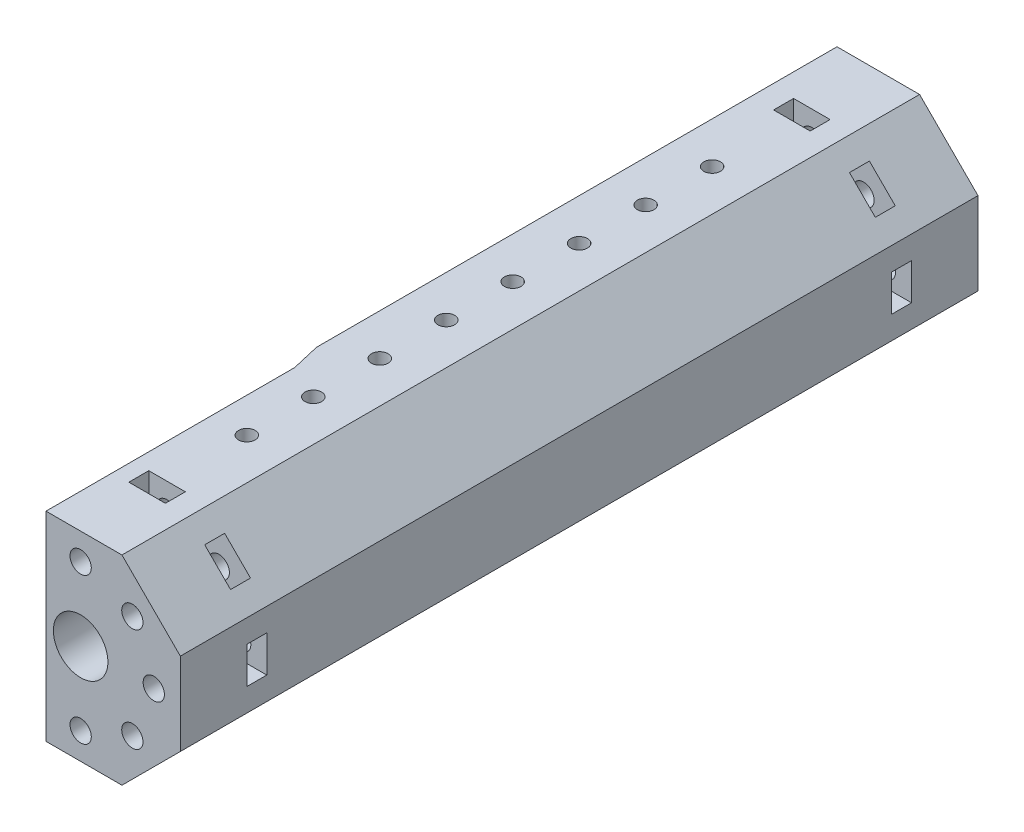
from build123d import *

# Parameters (mm, degrees)
SALIENTE_EXTRUIR1_DEPTH = 60
CROQUIS2_R              = 1.6
CORTAR_EXTRUIR1_DEPTH   = 20
CORTAR_EXTRUIR2_START   = -10
CORTAR_EXTRUIR2_DEPTH   = 3
CROQUIS4_R              = 4.1
CORTAR_EXTRUIR3_DEPTH   = 122.86057607
CORTAR_EXTRUIR4_DEPTH   = 125.599357944
CORTAR_EXTRUIR5_START   = -20
CROQUIS6_R              = 1.6
CORTAR_EXTRUIR5_DEPTH   = 20
CORTAR_EXTRUIR6_START   = -10
CORTAR_EXTRUIR6_DEPTH   = 3
CROQUIS8_R              = 1.25
CORTAR_EXTRUIR8_DEPTH   = 125.599357944
MATRIZL1_COUNT          = 8
MATRIZL1_PITCH          = 10
CHAFL_N1_SIZE           = 1


with BuildPart() as part:
    # Croquis1 → Saliente-Extruir1 (new body)
    with BuildSketch(Plane.XY):
        Polygon((15, -6.213203436), (15, 6.213203436), (6.213203436, 15), (-6.213203436, 15), (-15, 6.213203436), (-15, -6.213203436), (-6.213203436, -15), (6.213203436, -15), align=None)
    saliente_extruir1 = extrude(amount=SALIENTE_EXTRUIR1_DEPTH)

    # Croquis2 → Cortar-Extruir1 (cut)
    with BuildSketch(Plane(origin=(0, 0, 0), x_dir=(-1, 0, 0), z_dir=(0, 0, -1))):
        with Locations((0, 11)):
            Circle(CROQUIS2_R)
        with Locations((7.778174593, 7.778174593)):
            Circle(CROQUIS2_R)
        with Locations((11, 0)):
            Circle(CROQUIS2_R)
        with Locations((7.778174593, -7.778174593)):
            Circle(CROQUIS2_R)
        with Locations((0, -11)):
            Circle(CROQUIS2_R)
        with Locations((-7.778174593, -7.778174593)):
            Circle(CROQUIS2_R)
        with Locations((-11, 0)):
            Circle(CROQUIS2_R)
        with Locations((-7.778174593, 7.778174593)):
            Circle(CROQUIS2_R)
    extrude(amount=-CORTAR_EXTRUIR1_DEPTH, mode=Mode.SUBTRACT)

    # Croquis3 → Cortar-Extruir2 (cut)
    with BuildSketch(Plane(origin=(0, 0, 0), x_dir=(-1, 0, 0), z_dir=(0, 0, -1)).offset(CORTAR_EXTRUIR2_START)):
        Polygon((-2.75, 12.58771324), (-2.75, 18.463203436), (2.75, 23.963203436), (2.75, 12.58771324), (2.75, 9.41228676), (0, 7.824573519), (-2.75, 9.41228676), align=None)
        Polygon((6.956313744, 10.84540104), (11.110912703, 15), (18.889087297, 15), (10.84540104, 6.956313744), (8.600035443, 4.710948146), (5.532808996, 5.532808996), (4.710948146, 8.600035443), align=None)
        Polygon((12.58771324, 2.75), (18.463203436, 2.75), (23.963203436, -2.75), (12.58771324, -2.75), (9.41228676, -2.75), (7.824573519, 0), (9.41228676, 2.75), align=None)
        Polygon((10.84540104, -6.956313744), (15, -11.110912703), (15, -18.889087297), (6.956313744, -10.84540104), (4.710948146, -8.600035443), (5.532808996, -5.532808996), (8.600035443, -4.710948146), align=None)
        Polygon((2.75, -12.58771324), (2.75, -18.463203436), (-2.75, -23.963203436), (-2.75, -12.58771324), (-2.75, -9.41228676), (0, -7.824573519), (2.75, -9.41228676), align=None)
        Polygon((-6.956313744, -10.84540104), (-11.110912703, -15), (-18.889087297, -15), (-10.84540104, -6.956313744), (-8.600035443, -4.710948146), (-5.532808995, -5.532808996), (-4.710948146, -8.600035443), align=None)
        Polygon((-12.58771324, -2.75), (-18.463203436, -2.75), (-23.963203436, 2.75), (-12.58771324, 2.75), (-9.41228676, 2.75), (-7.824573519, 0), (-9.41228676, -2.75), align=None)
        Polygon((-10.84540104, 6.956313744), (-15, 11.110912703), (-15, 18.889087297), (-6.956313744, 10.84540104), (-4.710948146, 8.600035443), (-5.532808996, 5.532808996), (-8.600035443, 4.710948146), align=None)
    extrude(amount=-CORTAR_EXTRUIR2_DEPTH, mode=Mode.SUBTRACT)

    # Simetría1: Saliente-Extruir1 across plane
    add(saliente_extruir1.mirror(Plane.XY.offset(60)))

    # Croquis4 → Cortar-Extruir3 (cut, through all)
    with BuildSketch(Plane(origin=(0, 0, 0), x_dir=(-1, 0, 0), z_dir=(0, 0, -1))):
        Circle(CROQUIS4_R)
    extrude(amount=-CORTAR_EXTRUIR3_DEPTH, mode=Mode.SUBTRACT)

    # Croquis5 → Cortar-Extruir4 (cut, through all)
    with BuildSketch(Plane.XZ.offset(15)):
        Polygon((-6.213203436, 120), (-6.213203436, 78.298736304), (-15, 40.569524353), (-15, 120), align=None)
    extrude(amount=-CORTAR_EXTRUIR4_DEPTH, mode=Mode.SUBTRACT)

    # Croquis6 → Cortar-Extruir5 (cut)
    with BuildSketch(Plane.XY.offset(120).offset(CORTAR_EXTRUIR5_START)):
        with Locations((0, 11)):
            Circle(CROQUIS6_R)
        with Locations((7.778174593, 7.778174593)):
            Circle(CROQUIS6_R)
        with Locations((11, 0)):
            Circle(CROQUIS6_R)
        with Locations((7.778174593, -7.778174593)):
            Circle(CROQUIS6_R)
        with Locations((0, -11)):
            Circle(CROQUIS6_R)
    extrude(amount=CORTAR_EXTRUIR5_DEPTH, mode=Mode.SUBTRACT)

    # Croquis7 → Cortar-Extruir6 (cut)
    with BuildSketch(Plane.XY.offset(120).offset(CORTAR_EXTRUIR6_START)):
        Polygon((-2.75, 12.58771324), (-2.75, 18.463203436), (2.75, 23.963203436), (2.75, 12.58771324), (2.75, 9.41228676), (0, 7.824573519), (-2.75, 9.41228676), align=None)
        Polygon((6.956313744, 10.84540104), (11.110912703, 15), (18.889087297, 15), (10.84540104, 6.956313744), (8.600035443, 4.710948146), (5.532808996, 5.532808996), (4.710948146, 8.600035443), align=None)
        Polygon((12.58771324, 2.75), (18.463203436, 2.75), (23.963203436, -2.75), (12.58771324, -2.75), (9.41228676, -2.75), (7.824573519, 0), (9.41228676, 2.75), align=None)
        Polygon((10.84540104, -6.956313744), (15, -11.110912703), (15, -18.889087297), (6.956313744, -10.84540104), (4.710948146, -8.600035443), (5.532808996, -5.532808996), (8.600035443, -4.710948146), align=None)
        Polygon((2.75, -12.58771324), (2.75, -18.463203436), (-2.75, -23.963203436), (-2.75, -12.58771324), (-2.75, -9.41228676), (0, -7.824573519), (2.75, -9.41228676), align=None)
    extrude(amount=-CORTAR_EXTRUIR6_DEPTH, mode=Mode.SUBTRACT)

    # Croquis8 → Cortar-Extruir8 (cut, through all)
    with BuildSketch(Plane.XZ.offset(15)):
        with Locations((0, 25)):
            Circle(CROQUIS8_R)
    cortar_extruir8 = extrude(amount=-CORTAR_EXTRUIR8_DEPTH, mode=Mode.SUBTRACT)

    # MatrizL1: Cortar-Extruir8 ×8
    with Locations(*[(0, 0, i * MATRIZL1_PITCH) for i in range(1, MATRIZL1_COUNT)]):
        add(cortar_extruir8, mode=Mode.SUBTRACT)

    # Chaflán1
    chafl_n1_edges = [part.edges().sort_by_distance(p)[0] for p in [
        (-6.213203436, 15, 99.149368152),
        (-6.213203436, -15, 99.149368152),
        (-6.213203436, 0, 120),
    ]]
    chamfer(chafl_n1_edges, length=CHAFL_N1_SIZE)


solid = part.part
